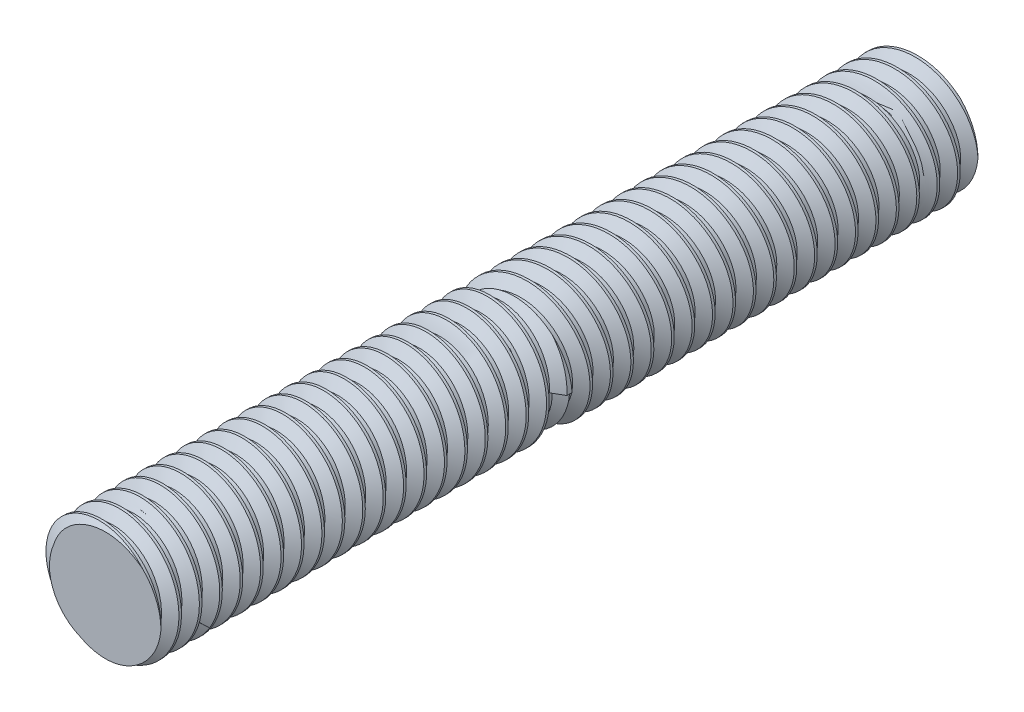
from build123d import *

# Parameters (mm, degrees)
SKETCH2_R           = 1.5
BOSS_EXTRUDE1_DEPTH = 20
THREAD1_PITCH       = 0.5


with BuildPart() as part:
    # Sketch2 → Boss-Extrude1 (new body)
    with BuildSketch(Plane.XY):
        Circle(SKETCH2_R)
    extrude(amount=BOSS_EXTRUDE1_DEPTH)

    # Thread1: arcs per turn and ends read off the stored shape
    # Thread1: the profile of Thread Profile1 profile screwed along a right-hand helix through 22 turns, 6 arcs to a turn; built about Z, then put on its axis
    thread1_z = Axis((0, 0, 0), (0, 0, 1))
    thread1_corners = [(1.5003, 0, -0.000173205), (1.5003, 0, 0.437673204), (1.229367062, 0, 0.281249999), (1.229367062, 0, 0.156249999)]
    with BuildLine(mode=Mode.PRIVATE) as thread1_profile:
        Line(thread1_corners[0], thread1_corners[1])
        Line(thread1_corners[1], thread1_corners[2])
        Line(thread1_corners[2], thread1_corners[3])
        Line(thread1_corners[3], thread1_corners[0])
    thread1_cap = Face(thread1_profile.wire())
    thread1_turn_angles = [0, 30, 60, 90, 120, 150, 180, 210, 240, 270, 300, 330, 360]
    thread1_turn_weights = [1, 0.8660254037844387, 1, 0.8660254037844387, 1, 0.8660254037844387, 1, 0.8660254037844387, 1, 0.8660254037844387, 1, 0.8660254037844387, 1]
    thread1_turn_rails = [Edge.make_bspline([Vector(p[0], p[1], 0).rotate(thread1_z, thread1_turn_angles[k]) / thread1_turn_weights[k] + Vector(0, 0, p[2] + THREAD1_PITCH * thread1_turn_angles[k] / 360) for k in range(13)], [0, 0, 0, 1, 1, 2, 2, 3, 3, 4, 4, 5, 5, 6, 6, 6], 2, thread1_turn_weights) for p in thread1_corners]
    thread1_turn_sides = [Face.make_surface_from_curves(thread1_turn_rails[p[0]], thread1_turn_rails[p[1]]) for p in [(0, 1), (1, 2), (2, 3), (3, 0)]]
    thread1 = Plane(origin=(0, 0, -1), x_dir=(1, 0, 0), z_dir=(0, 0, 1)) * Solid(Shell([*[p.moved(Location((0, 0, THREAD1_PITCH * i))) for i in range(22) for p in thread1_turn_sides], thread1_cap, thread1_cap.rotate(thread1_z, 7920).moved(Location((0, 0, THREAD1_PITCH * 7920 / 360)))]))
    add(thread1, mode=Mode.SUBTRACT)

    # Mirror3: Thread1 across plane
    add(thread1.mirror(Plane(origin=(0, 0, 10), x_dir=(1, 0, 0), z_dir=(0, 0, -1))), mode=Mode.SUBTRACT)


solid = part.part
